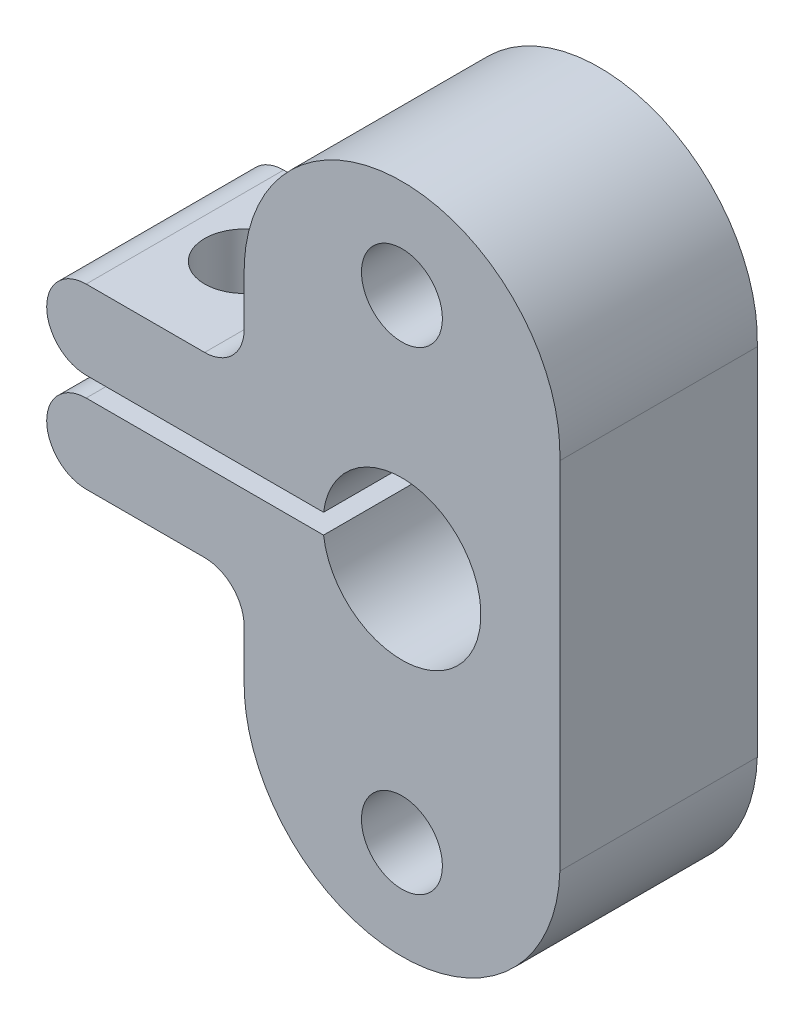
from build123d import *

# Parameters (mm, degrees)
ESBO_O1_R                = 2.05
RESSALTO_EXTRUS_O1_DEPTH = 10
CORTE_EXTRUS_O1_REACH    = 31.766
ESBO_O2_R                = 2
FILETE1_R                = 2


with BuildPart() as part:
    # Esboço1 → Ressalto-extrusão1 (new body)
    with BuildSketch(Plane.XY):
        with BuildLine():
            Line((-7.992042116, -8.75), (-7.992042116, -4.5))
            Line((-7.992042116, -4.5), (-17.992042116, -4.5))
            Line((-17.992042116, -4.5), (-17.992042116, -0.5))
            Line((-17.992042116, -0.5), (-8, -0.5))
            Line((-8, -0.5), (-3.968626967, -0.5))
            ThreePointArc((-3.968626967, -0.5), (4, 0), (-3.968626967, 0.5))
            Line((-3.968626967, 0.5), (-8, 0.5))
            Line((-8, 0.5), (-17.992042116, 0.5))
            Line((-17.992042116, 0.5), (-17.992042116, 4.5))
            Line((-17.992042116, 4.5), (-7.992042116, 4.5))
            Line((-7.992042116, 4.5), (-7.992042116, 8.75))
            ThreePointArc((-7.992042116, 8.75), (0.005510323, 17.001506438), (7.999953669, 8.74698773))
            Line((7.999953669, 8.74698773), (8.000049012, -9.25301227))
            ThreePointArc((8.000049012, -9.25301227), (-0.247502701, -16.997552144), (-7.992042116, -8.75))
        make_face()
        with Locations((0, 12)):
            Circle(ESBO_O1_R, mode=Mode.SUBTRACT)
        with Locations((0, -12)):
            Circle(ESBO_O1_R, mode=Mode.SUBTRACT)
    extrude(amount=RESSALTO_EXTRUS_O1_DEPTH)

    # Corte-extrusão1: up to this face of the body (flat: up to its plane)
    corte_extrus_o1_end = Plane(part.part.faces().sort_by_distance((-12.992042116, 4.5, 5))[0])
    # Esboço2 → Corte-extrusão1 (cut, up to the picked face)
    with BuildSketch(Plane.XZ.offset(4.5), mode=Mode.PRIVATE) as corte_extrus_o1_sk1:
        with Locations((-12.992042116, 5)):
            Circle(ESBO_O2_R)
    corte_extrus_o1_tool1 = split(extrude(corte_extrus_o1_sk1.sketch, amount=-CORTE_EXTRUS_O1_REACH, mode=Mode.PRIVATE), bisect_by=corte_extrus_o1_end, keep=Keep.BOTH, mode=Mode.PRIVATE)
    add(corte_extrus_o1_tool1.solids().sort_by(Axis((-12.992042, -4.5, 5), (0, 1, 0)))[0], mode=Mode.SUBTRACT)

    # Filete1
    filete1_edges = [part.edges().sort_by_distance(p)[0] for p in [
        (-7.992042116, -4.5, 5),
        (-7.992042116, 4.5, 5),
        (-17.992042116, -4.5, 5),
        (-17.992042116, 0.5, 5),
        (-17.992042116, -0.5, 5),
        (-17.992042116, 4.5, 5),
    ]]
    fillet(filete1_edges, radius=FILETE1_R - 0.0001)  # a hair under: the kernel refuses the full size


solid = part.part
